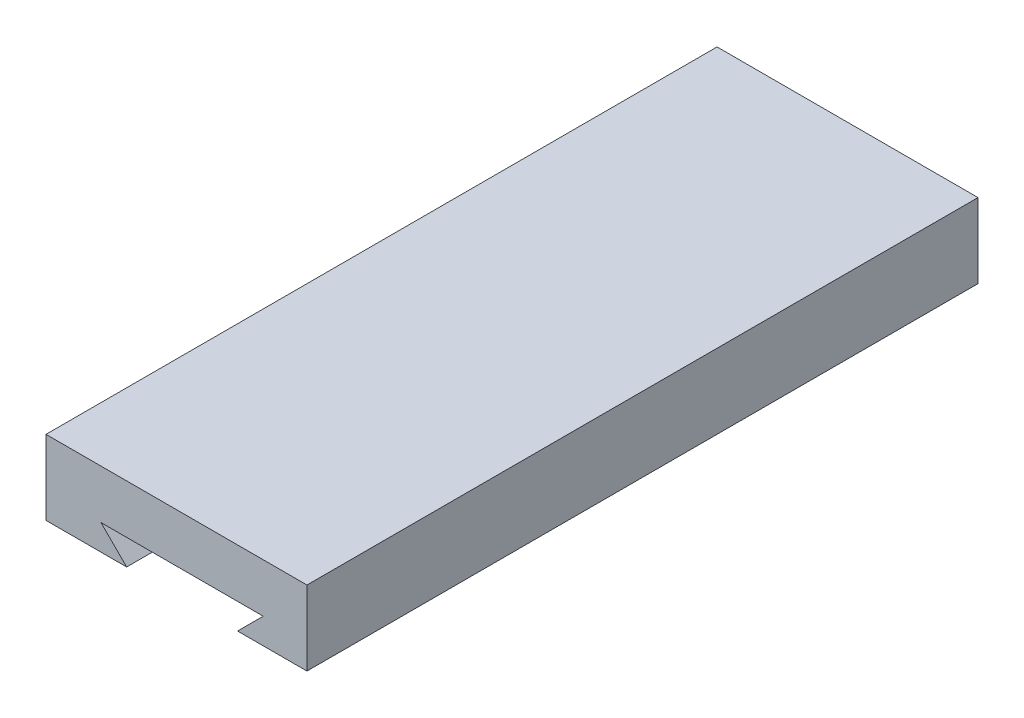
from build123d import *

# Parameters (mm, degrees)
SKETCH1_W               = 70
SKETCH1_H               = 20
BOSS_EXTRUDE1_DEPTH     = 180
CUT_EXTRUDE1_DEPTH      = 187.146063222
CUT_EXTRUDE1_DEPTH_BACK = 180


with BuildPart() as part:
    # Sketch1 → Boss-Extrude1 (new body)
    with BuildSketch(Plane.XY):
        with Locations((-6.021069692, 13.824959481)):
            Rectangle(SKETCH1_W, SKETCH1_H)
    extrude(amount=BOSS_EXTRUDE1_DEPTH)

    # Sketch2 → Cut-Extrude1 (cut, two sides: drawn at the far end of the back side and taken through both)
    with BuildSketch(Plane.XY.offset(180).offset(-CUT_EXTRUDE1_DEPTH_BACK)):
        Polygon((-19.386877051, 3.824959481), (-26.266813754, 10.704896184), (17.240735557, 10.704896184), (10.360798855, 3.824959481), align=None)
    extrude(amount=CUT_EXTRUDE1_DEPTH + CUT_EXTRUDE1_DEPTH_BACK, mode=Mode.SUBTRACT)


solid = part.part
